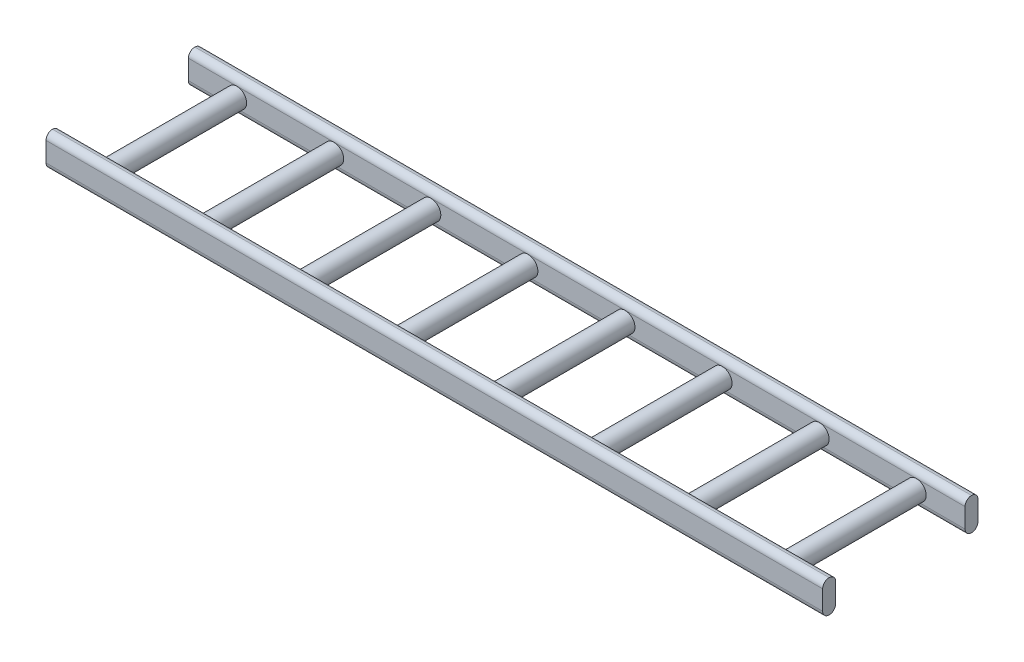
from build123d import *

# Parameters (mm, degrees)
SKETCH3_W           = 150
SKETCH3_H           = 50
BOSS_EXTRUDE1_DEPTH = 20
SKETCH4_R           = 15
BOSS_EXTRUDE2_DEPTH = 200
SKETCH5_W           = 150
SKETCH5_H           = 50
BOSS_EXTRUDE3_DEPTH = 20
FILLET2_R           = 10


with BuildPart() as part:
    # Sketch3 → Boss-Extrude1 (new body)
    with BuildSketch(Plane.XY):
        Rectangle(SKETCH3_W, SKETCH3_H)
    extrude(amount=BOSS_EXTRUDE1_DEPTH)

    # Sketch4 → Boss-Extrude2 (add)
    with BuildSketch(Plane.XY.offset(20)):
        Circle(SKETCH4_R)
    extrude(amount=BOSS_EXTRUDE2_DEPTH)

    # Sketch5 → Boss-Extrude3 (add)
    with BuildSketch(Plane.XY.offset(220)):
        Rectangle(SKETCH5_W, SKETCH5_H)
    extrude(amount=BOSS_EXTRUDE3_DEPTH)

    # Mirror1: part across plane


with BuildPart() as part_1:
    add(part.part)
    add(part.part.mirror(Plane(origin=(75, -25, 20), x_dir=(0, 0, 1), z_dir=(-1, 0, 0))))

    # Mirror2: part across plane


with BuildPart() as part_2:
    add(part_1.part)
    add(part_1.part.mirror(Plane(origin=(225, 25, 240), x_dir=(0, 0, 1), z_dir=(-1, 0, 0))))

    # Mirror3: part across plane


with BuildPart() as part_3:
    add(part_2.part)
    add(part_2.part.mirror(Plane(origin=(525, 25, 240), x_dir=(0, 0, 1), z_dir=(-1, 0, 0))))

    # Fillet2
    fillet2_edges = [part_3.edges().sort_by_distance(p)[0] for p in [
        (525, -25, 20),
        (525, -25, 0),
        (525, 25, 0),
        (525, 25, 20),
        (525, 25, 220),
        (525, 25, 240),
        (525, -25, 220),
        (525, -25, 240),
    ]]
    fillet(fillet2_edges, radius=FILLET2_R - 0.0001)  # a hair under: the kernel refuses the full size


solid = part_3.part
